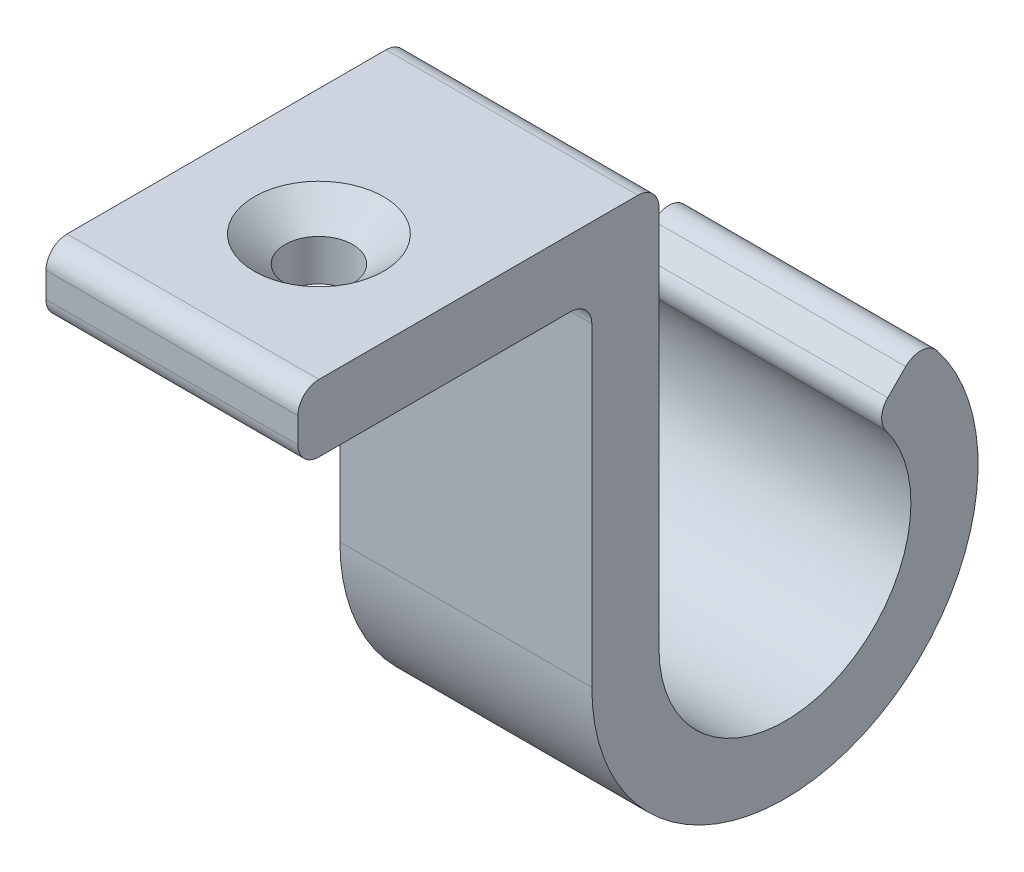
from build123d import *

# Parameters (mm, degrees)
BOSS_EXTRUDE1_DEPTH                                = 9.525
FILLET1_R                                          = 1.5875
CSK_FOR_10_FLAT_HEAD_MACHINE_SCREW_100_D           = 5.1054
CSK_FOR_10_FLAT_HEAD_MACHINE_SCREW_100_CSINK_D     = 9.779
CSK_FOR_10_FLAT_HEAD_MACHINE_SCREW_100_CSINK_ANGLE = 100


with BuildPart() as part:
    # Sketch1 → Boss-Extrude1 (new, symmetric)
    with BuildSketch(Plane(origin=(0, 0, 0), x_dir=(0, 0, -1), z_dir=(1, 0, 0))):
        with BuildLine():
            Line((-13.6525, -2.54), (8.5725, -2.54))
            Line((8.5725, -2.54), (8.5725, -27.94))
            ThreePointArc((8.5725, -27.94), (28.76659153, -41.433260572), (33.504794539, -17.612705461))
            Line((33.504794539, -17.612705461), (29.912692091, -21.204807909))
            ThreePointArc((29.912692091, -21.204807909), (26.822559693, -36.739952547), (13.6525, -27.94))
            Line((13.6525, -27.94), (13.6525, 2.54))
            Line((13.6525, 2.54), (-13.6525, 2.54))
            Line((-13.6525, 2.54), (-13.6525, -2.54))
        make_face()
    extrude(amount=BOSS_EXTRUDE1_DEPTH, both=True)

    # Fillet1
    fillet1_edges = [part.edges().sort_by_distance(p)[0] for p in [
        (0, 2.54, 13.6525),
        (0, -2.54, 13.6525),
        (0, -2.54, -8.5725),
        (0, 2.54, -13.6525),
        (0, -17.612705461, -33.504794539),
        (0, -21.204807909, -29.912692091),
    ]]
    fillet(fillet1_edges, radius=FILLET1_R)

    # CSK for #10 Flat Head Machine Screw (100)1 (through all)
    with Locations(Plane(origin=(0, 2.54, 2.54), x_dir=(0, 0, 1), z_dir=(0, 1, 0))):
        with Locations((0, 0)):
            CounterSinkHole(CSK_FOR_10_FLAT_HEAD_MACHINE_SCREW_100_D / 2, CSK_FOR_10_FLAT_HEAD_MACHINE_SCREW_100_CSINK_D / 2, counter_sink_angle=CSK_FOR_10_FLAT_HEAD_MACHINE_SCREW_100_CSINK_ANGLE)


solid = part.part
